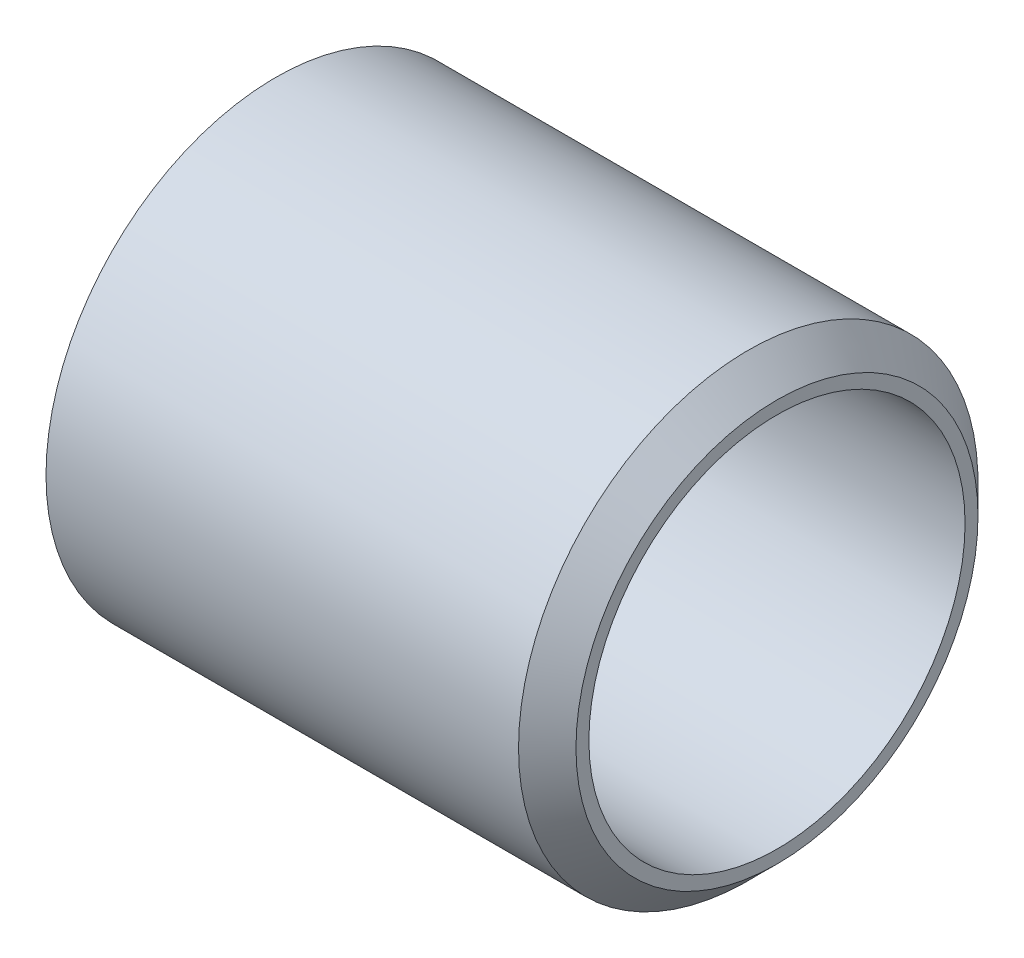
from build123d import *


with BuildPart() as part:
    # Sketch1 → BaseBody (revolve)
    with BuildSketch(Plane.XY):
        with BuildLine():
            Line((0, 31.76905), (0, 34.925))
            Line((0, 34.925), (71.834375, 34.925))
            Line((71.834375, 34.925), (76.2, 30.559375))
            Line((76.2, 30.559375), (76.2, 28.59405))
            Line((76.2, 28.59405), (3.175, 28.59405))
            ThreePointArc((3.175, 28.59405), (0.92993597, 29.52398597), (0, 31.76905))
        make_face()
    revolve(axis=Axis((0, 0, 0), (1, 0, 0)))


solid = part.part
